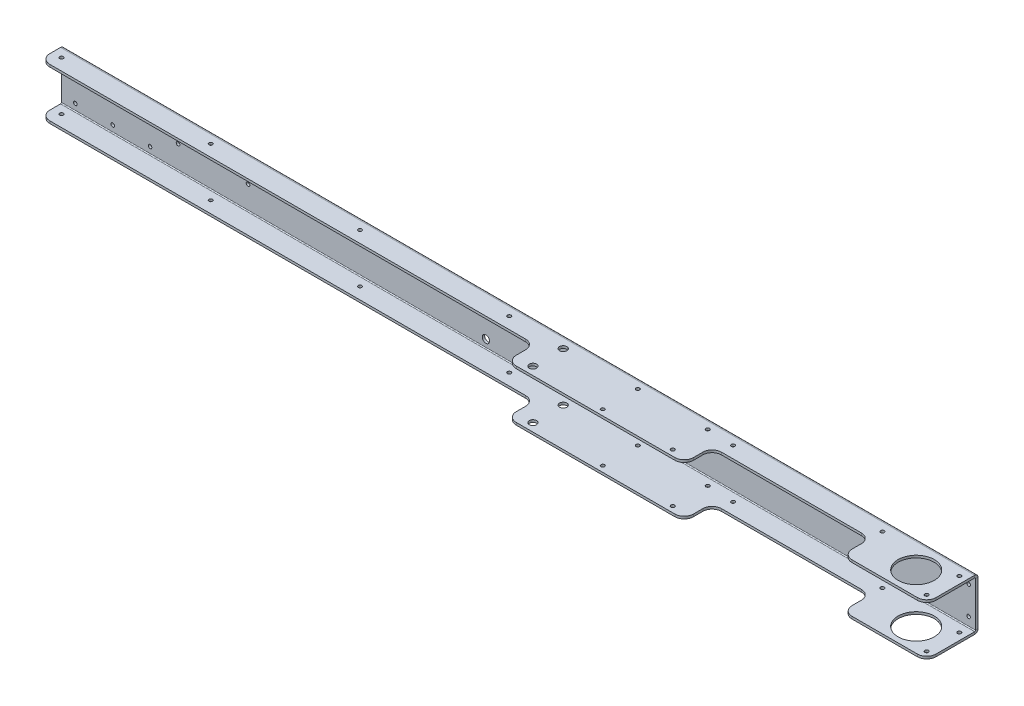
from build123d import *

# Parameters (mm, degrees)
SKETCH2_W                        = 1244.6
SKETCH2_H                        = 69.85
BASE_FLANGE1_DEPTH               = 3.2639
EDGE_FLANGE1_STRIP_W             = 15.5956
EDGE_FLANGE1_STRIP_H             = 3.2639
EDGE_FLANGE1_STRIP_CUT_DEPTH     = 1244.6
EDGE_FLANGE1_STRIP_2_W           = 15.5956
EDGE_FLANGE1_STRIP_2_H           = 3.2639
EDGE_FLANGE1_STRIP_CUT_2_DEPTH   = 1244.6
EDGE_FLANGE1_DEPTH               = 1244.6
EDGE_FLANGE1_BEND_DEPTH          = 1244.6
F_10_0_1935_DIAMETER_HOLE1_D     = 4.9149
SKETCH28_R                       = 24.60625
CUT_EXTRUDE1_DEPTH               = 630.738057619
F_10_0_1935_DIAMETER_HOLE5_D     = 4.9149
F_10_0_1935_DIAMETER_HOLE6_D     = 4.9149
F_10_0_1935_DIAMETER_HOLE7_D     = 4.9149
F_25_64_0_39063_DIAMETER_HOLE1_D = 9.922002
F_25_64_0_39063_DIAMETER_HOLE2_D = 9.922002
F_10_0_1935_DIAMETER_HOLE9_D     = 4.9149
LPATTERN1_COUNT                  = 13
LPATTERN1_PITCH                  = 101.6
F_10_0_1935_DIAMETER_HOLE10_D    = 4.9149
F_10_0_1935_DIAMETER_HOLE11_D    = 4.9149
SKETCH69_W                       = 673.1
SKETCH69_H                       = 38.1
SKETCH69_W_2                     = 215.9
CUT_EXTRUDE2_DEPTH               = 630.738057619
FILLET3_R                        = 12.7


# Sheet-metal steps are written as plain solids
with BuildPart() as part:
    # Sketch2 → Base-Flange1 (new body)
    with BuildSketch(Plane.XY):
        Rectangle(SKETCH2_W, SKETCH2_H)
    extrude(amount=-BASE_FLANGE1_DEPTH)

    # Edge-Flange1 strip (across the edge) → Edge-Flange1 strip cut (cut)
    with BuildSketch(Plane(origin=(622.3, 34.925, 0), x_dir=(0, -1, 0), z_dir=(-1, 0, 0))):
        with Locations((-3.2639, -1.63195)):
            Rectangle(EDGE_FLANGE1_STRIP_W, EDGE_FLANGE1_STRIP_H)
    extrude(amount=EDGE_FLANGE1_STRIP_CUT_DEPTH, mode=Mode.SUBTRACT)

    # Edge-Flange1 strip 2 (across the edge) → Edge-Flange1 strip cut 2 (cut)
    with BuildSketch(Plane(origin=(-622.3, -34.925, 0), x_dir=(0, 1, 0), z_dir=(1, 0, 0))):
        with Locations((-3.2639, -1.63195)):
            Rectangle(EDGE_FLANGE1_STRIP_2_W, EDGE_FLANGE1_STRIP_2_H)
    extrude(amount=EDGE_FLANGE1_STRIP_CUT_2_DEPTH, mode=Mode.SUBTRACT)

    # Edge-Flange1 section (across the edge) → Edge-Flange1 (add)
    with BuildSketch(Plane(origin=(622.3, 34.925, 0), x_dir=(0, -1, 0), z_dir=(-1, 0, 0))):
        with BuildLine():
            Line((0, 1.27), (0, 66.5861))
            Line((0, 66.5861), (3.2639, 66.5861))
            Line((3.2639, 66.5861), (3.2639, 1.27))
            ThreePointArc((3.2639, 1.27), (3.635874388, 0.371974388), (4.5339, 0))
            Line((4.5339, 0), (4.5339, -3.2639))
            ThreePointArc((4.5339, -3.2639), (1.327948565, -1.935951435), (0, 1.27))
        make_face()
    extrude(amount=EDGE_FLANGE1_DEPTH)

    # Edge-Flange1 section 2 (across the edge) → Edge-Flange1 bend (add)
    with BuildSketch(Plane(origin=(-622.3, -34.925, 0), x_dir=(0, 1, 0), z_dir=(1, 0, 0))):
        with BuildLine():
            Line((0, 1.27), (0, 66.5861))
            Line((0, 66.5861), (3.2639, 66.5861))
            Line((3.2639, 66.5861), (3.2639, 1.27))
            ThreePointArc((3.2639, 1.27), (3.635874388, 0.371974388), (4.5339, 0))
            Line((4.5339, 0), (4.5339, -3.2639))
            ThreePointArc((4.5339, -3.2639), (1.327948565, -1.935951435), (0, 1.27))
        make_face()
    extrude(amount=EDGE_FLANGE1_BEND_DEPTH)

    # #10 (0.1935) Diameter Hole1 (through all)
    with Locations(Plane(origin=(0, 0, -3.2639), x_dir=(-1, 0, 0), z_dir=(0, 0, -1))):
        with Locations((552.45, 22.225), (603.25, 22.225), (603.25, -22.225), (552.45, -22.225), (501.65, -22.225), (501.65, 22.225)):
            Hole(F_10_0_1935_DIAMETER_HOLE1_D / 2)

    # Sketch28 → Cut-Extrude1 (cut, through all)
    with BuildSketch(Plane.XZ.offset(34.925)):
        with Locations(Location((576.2625, 34.8361, 0), (0, 0, 270))):
            Circle(SKETCH28_R)
    extrude(amount=-CUT_EXTRUDE1_DEPTH, mode=Mode.SUBTRACT)

    # #10 (0.1935) Diameter Hole5 (through all)
    with Locations(Plane(origin=(0, -34.925, 0), x_dir=(-1, 0, 0), z_dir=(0, -1, 0))):
        with Locations((-173.38675, -58.6486), (-173.38675, -11.0236), (-268.63675, -58.6486), (-268.63675, -11.0236)):
            Hole(F_10_0_1935_DIAMETER_HOLE5_D / 2)

    # #10 (0.1935) Diameter Hole6 (through all)
    with Locations(Plane(origin=(0, 0, -3.2639), x_dir=(-1, 0, 0), z_dir=(0, 0, -1))):
        with Locations((-233.71175, 22.225), (-208.31175, 22.225), (-208.31175, -22.225), (-233.71175, -22.225)):
            Hole(F_10_0_1935_DIAMETER_HOLE6_D / 2)

    # #10 (0.1935) Diameter Hole7 (through all)
    with Locations(Plane(origin=(0, 0, -3.2639), x_dir=(-1, 0, 0), z_dir=(0, 0, -1))):
        with Locations((463.55, 0), (368.3, 0)):
            Hole(F_10_0_1935_DIAMETER_HOLE7_D / 2)

    # 25/64 (0.39063) Diameter Hole1 (through all)
    with Locations(Plane(origin=(0, 0, -3.2639), x_dir=(-1, 0, 0), z_dir=(0, 0, -1))):
        with Locations((44.41825, -20.6375), (44.41825, 20.6375)):
            Hole(F_25_64_0_39063_DIAMETER_HOLE1_D / 2)

    # 25/64 (0.39063) Diameter Hole2 (through all)
    with Locations(Plane(origin=(0, 34.925, 0), x_dir=(1, 0, 0), z_dir=(0, 1, 0))):
        with Locations((75.05065, -14.1986), (75.05065, -55.4736)):
            Hole(F_25_64_0_39063_DIAMETER_HOLE2_D / 2)

    # #10 (0.1935) Diameter Hole9 (through all)
    with Locations(Plane(origin=(0, -34.925, 0), x_dir=(-1, 0, 0), z_dir=(0, -1, 0))):
        with Locations((609.6, -12.6111)):
            f_10_0_1935_diameter_hole9 = Hole(F_10_0_1935_DIAMETER_HOLE9_D / 2)

    # LPattern1: #10 (0.1935) Diameter Hole9 ×13, 7 skipped
    with Locations(*[(i * LPATTERN1_PITCH, 0, 0) for i in range(1, LPATTERN1_COUNT) if i not in (1, 3, 5, 7, 8, 10, 12)]):
        add(f_10_0_1935_diameter_hole9, mode=Mode.SUBTRACT)

    # #10 (0.1935) Diameter Hole10 (through all)
    with Locations(Plane(origin=(0, 34.925, 0), x_dir=(1, 0, 0), z_dir=(0, 1, 0))):
        with Locations((612.775, -12.6111), (612.775, -57.0611)):
            Hole(F_10_0_1935_DIAMETER_HOLE10_D / 2)

    # #10 (0.1935) Diameter Hole11 (through all)
    with Locations(Plane(origin=(0, 0, -3.2639), x_dir=(-1, 0, 0), z_dir=(0, 0, -1))):
        with Locations((-612.775, 19.05), (-612.775, -19.05)):
            Hole(F_10_0_1935_DIAMETER_HOLE11_D / 2)

    # Sketch69 → Cut-Extrude2 (cut, through all)
    with BuildSketch(Plane(origin=(0, 34.925, 0), x_dir=(1, 0, 0), z_dir=(0, 1, 0))):
        with Locations((-285.75, -47.5361)):
            Rectangle(SKETCH69_W, SKETCH69_H)
        with Locations((400.05, -47.5361)):
            Rectangle(SKETCH69_W_2, SKETCH69_H)
    extrude(amount=-CUT_EXTRUDE2_DEPTH, mode=Mode.SUBTRACT)

    # Fillet3
    fillet3_edges = [part.edges().sort_by_distance(p)[0] for p in [
        (-622.3, 33.29305, 28.4861),
        (50.8, 33.29305, 66.5861),
        (50.8, 33.29305, 28.4861),
        (-622.3, -33.29305, 28.4861),
        (50.8, -33.29305, 28.4861),
        (50.8, -33.29305, 66.5861),
        (292.1, 33.29305, 28.4861),
        (508, 33.29305, 66.5861),
        (292.1, 33.29305, 66.5861),
        (508, 33.29305, 28.4861),
        (292.1, -33.29305, 66.5861),
        (292.1, -33.29305, 28.4861),
        (508, -33.29305, 28.4861),
        (508, -33.29305, 66.5861),
        (622.3, 33.29305, 66.5861),
        (622.3, -33.29305, 66.5861),
    ]]
    fillet(fillet3_edges, radius=FILLET3_R)


solid = part.part
